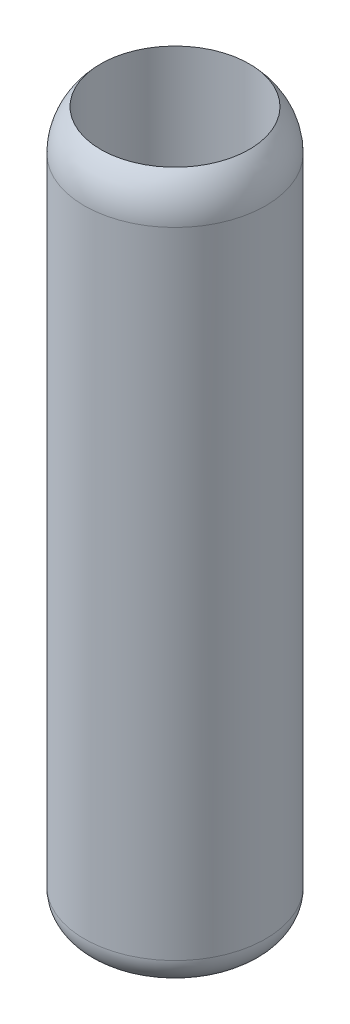
from build123d import *

# Parameters (mm, degrees)
SKETCH3_R           = 15.5
SKETCH3_R_2         = 12.7
BOSS_EXTRUDE5_DEPTH = 120
FILLET5_R           = 10
FILLET6_R           = 5


with BuildPart() as part:
    # Sketch3 → Boss-Extrude5 (new body)
    with BuildSketch(Plane(origin=(0, 0, 0), x_dir=(1, 0, 0), z_dir=(0, 1, 0))):
        with Locations(Location((0, 0, 0), (0, 0, 270))):
            Circle(SKETCH3_R)
        with Locations(Location((0, 0, 0), (0, 0, 270))):
            Circle(SKETCH3_R_2, mode=Mode.SUBTRACT)
    extrude(amount=BOSS_EXTRUDE5_DEPTH)

    # Fillet5
    # the kernel refuses this fillet: 10 mm, written as the material it takes off along each edge
    with BuildSketch(Plane(origin=(0, 120, 0), x_dir=(0, 0, 1), z_dir=(-1, 0, 0))) as fillet5_piece_1:
        with BuildLine():
            CenterArc((5.5, -6.939740629), FILLET5_R, 0, 43.945519562)
            Line((12.7, 0), (12.844, 0.138794813))
            ThreePointArc((12.844, 0.138794813), (14.1, 0.2), (15.5, 0.2))
            Line((15.5, 0.2), (15.7, 0))
            Line((15.7, 0), (15.7, -6.939740629))
            Line((15.7, -6.939740629), (15.5, -6.939740629))
        make_face()
    revolve(axis=Axis((0, 120, 0), (0, 1, 0)), mode=Mode.SUBTRACT)

    # Fillet6
    # the kernel refuses this fillet: 5 mm, written as the material it takes off along each edge
    with BuildSketch(Plane(origin=(0, 0, 0), x_dir=(0, 0, 1), z_dir=(-1, 0, 0))) as fillet6_piece_1:
        with BuildLine():
            CenterArc((10.5, 4.489988864), FILLET6_R, 296.103881137, 63.896118863)
            Line((12.7, 0), (12.744, -0.089799777))
            ThreePointArc((12.744, -0.089799777), (14.1, -0.1), (15.5, -0.1))
            Line((15.5, -0.1), (15.6, 0))
            Line((15.6, 0), (15.6, 4.489988864))
            Line((15.6, 4.489988864), (15.5, 4.489988864))
        make_face()
    revolve(axis=Axis((0, 0, 0), (0, 1, 0)), mode=Mode.SUBTRACT)


solid = part.part
